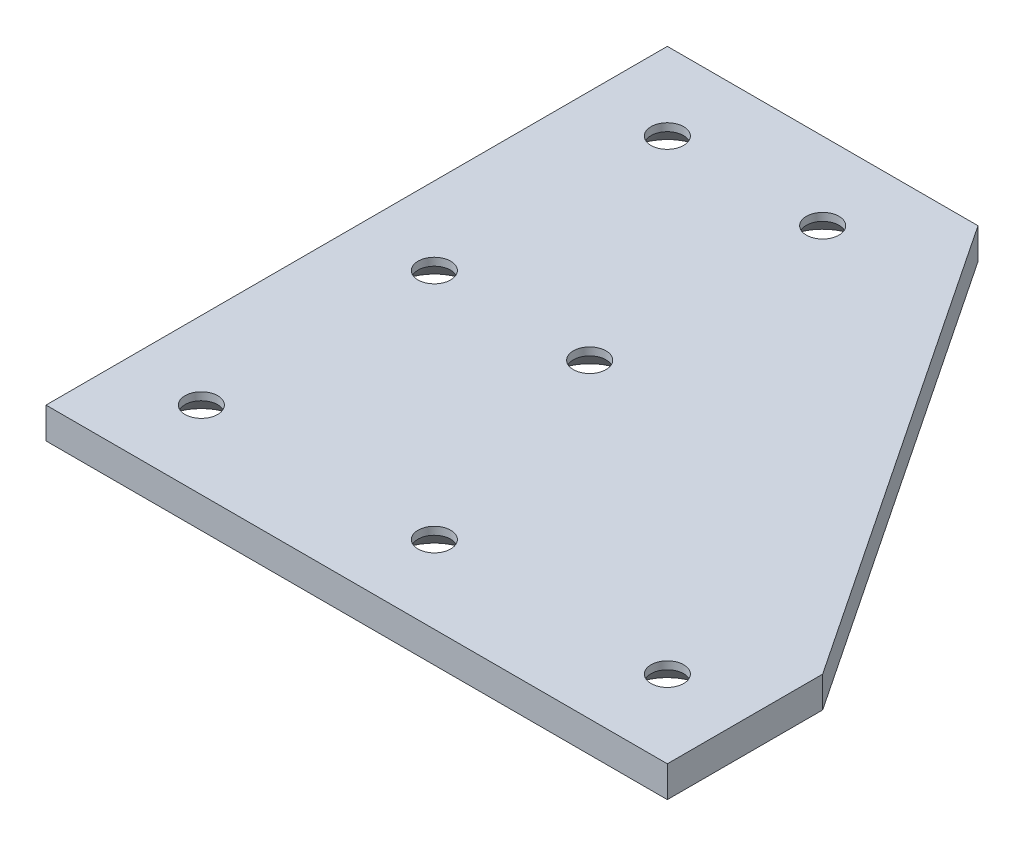
from build123d import *

# Parameters (mm, degrees)
BOSS_EXTRUDE1_DEPTH = 4
SKETCH2_R           = 2.1
CUT_EXTRUDE1_DEPTH  = 4
CHAMFER1_SIZE       = 3


with BuildPart() as part:
    # Sketch1 → Boss-Extrude1 (new body)
    with BuildSketch(Plane(origin=(0, 0, 0), x_dir=(1, 0, 0), z_dir=(0, 1, 0))):
        Polygon((0, 0), (80, 0), (80, 20), (40, 80), (0, 80), align=None)
    extrude(amount=BOSS_EXTRUDE1_DEPTH)

    # Sketch2 → Cut-Extrude1 (cut)
    with BuildSketch(Plane(origin=(0, 4, 0), x_dir=(1, 0, 0), z_dir=(0, 1, 0))):
        with Locations((10, 10)):
            Circle(SKETCH2_R)
        with Locations((40, 10)):
            Circle(SKETCH2_R)
        with Locations((70, 10)):
            Circle(SKETCH2_R)
        with Locations((30, 40)):
            Circle(SKETCH2_R)
        with Locations((30, 70)):
            Circle(SKETCH2_R)
        with Locations((10, 40)):
            Circle(SKETCH2_R)
        with Locations((10, 70)):
            Circle(SKETCH2_R)
    extrude(amount=-CUT_EXTRUDE1_DEPTH, mode=Mode.SUBTRACT)

    # Chamfer1
    chamfer1_edges = [part.edges().sort_by_distance(p)[0] for p in [
        (7.9, 0, -70),
        (27.9, 0, -70),
        (27.9, 0, -40),
        (7.9, 0, -40),
        (7.9, 0, -10),
        (37.9, 0, -10),
        (67.9, 0, -10),
    ]]
    chamfer(chamfer1_edges, length=CHAMFER1_SIZE)


solid = part.part
